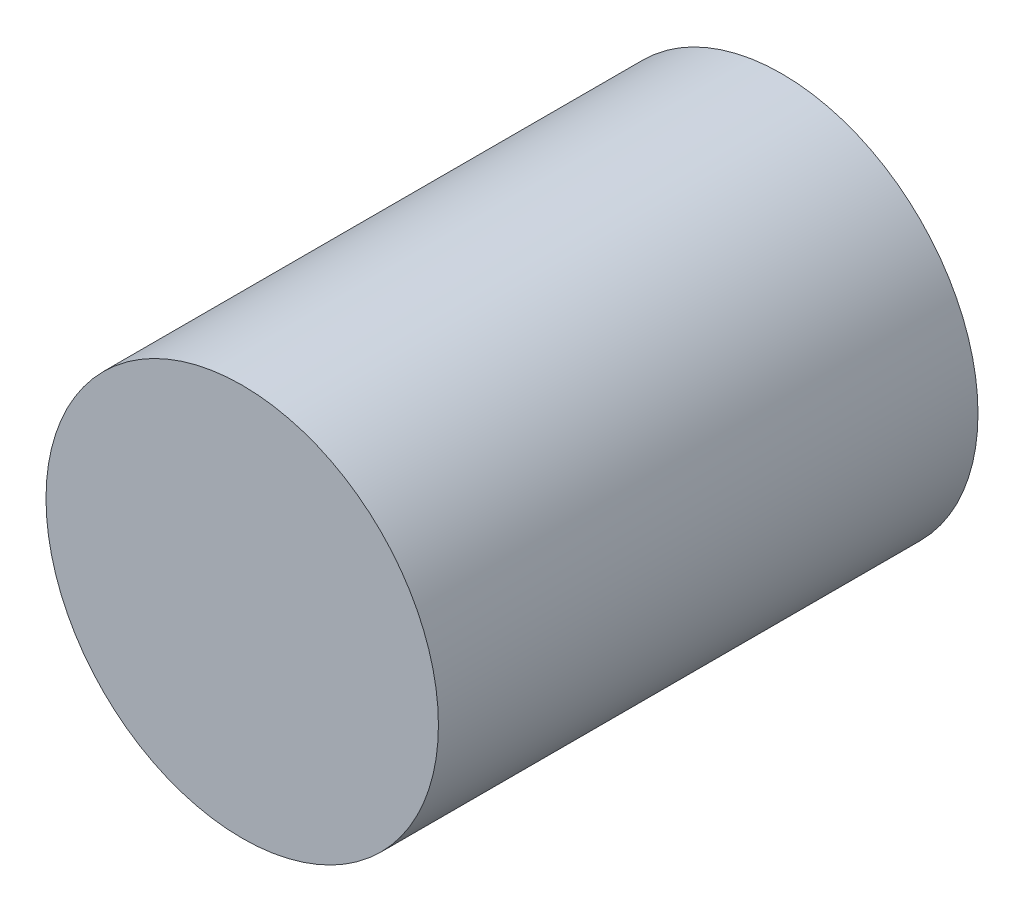
from build123d import *

# Parameters (mm, degrees)
IZIM1_R                     = 4
Y_KSEKLIK_EKSTR_ZYON1_DEPTH = 11


with BuildPart() as part:
    # Çizim1 → Yükseklik-Ekstrüzyon1 (new body)
    with BuildSketch(Plane.XY):
        Circle(IZIM1_R)
    extrude(amount=Y_KSEKLIK_EKSTR_ZYON1_DEPTH)


solid = part.part
